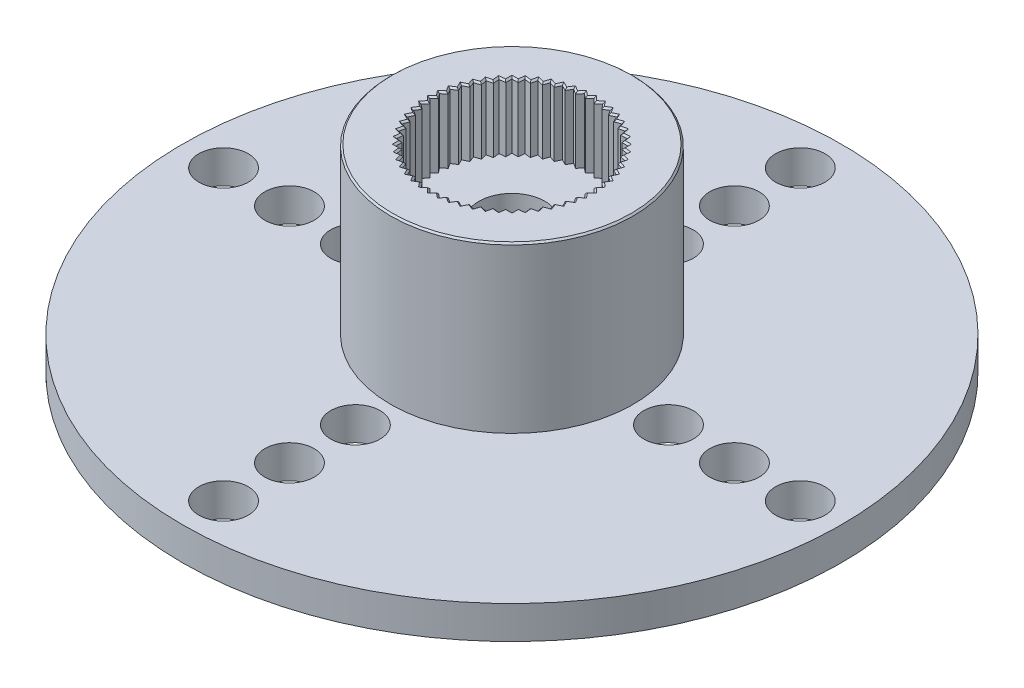
from build123d import *
from build123d.topology import SkipClean

# Parameters (mm, degrees)
SKETCH_1_R               = 0.75
SKETCH_1_R_2             = 1
EXTRUDE_1_DEPTH          = 1
SKETCH_2_R               = 3.67931812
EXTRUDE_2_DEPTH          = 5
SKETCH_1_4_R             = 1
CUT_EXTRUDE_2_DEPTH      = 13.228547822
SKETCH_3_R               = 2.355
CUT_EXTRUDE_3_DEPTH      = 2
CUT_EXTRUDE_4_REACH      = 13.381
PATTERN_CIRCULAR_1_COUNT = 56
CHAMFER_1_SIZE           = 0.05
SKETCH_6_R               = 0.75
EXTRUDE_3_DEPTH          = 1


with BuildPart() as part:
    # 草图1 → 凸台-拉伸1 (new body)
    with BuildSketch(Plane(origin=(0, 0, 0), x_dir=(1, 0, 0), z_dir=(0, 1, 0))):
        with BuildLine():
            Line((-2.945872845, 9.556245768), (-3.608885156, 1.677008569))
            ThreePointArc((-3.608885156, 1.677008569), (-3.67931812, 0), (-3.608885156, -1.677008569))
            Line((-3.608885156, -1.677008569), (-2.945872845, -9.556245768))
            ThreePointArc((-2.945872845, -9.556245768), (-1.489554001, -9.888439153), (2.6e-08, -10))
            ThreePointArc((2.6e-08, -10), (1.489554027, -9.888439149), (2.945872845, -9.556245768))
            Line((2.945872845, -9.556245768), (3.608885156, -1.677008569))
            ThreePointArc((3.608885156, -1.677008569), (3.67931812, 0), (3.608885156, 1.677008569))
            Line((3.608885156, 1.677008569), (2.945872845, 9.556245768))
            ThreePointArc((2.945872845, 9.556245768), (1.48955401, 9.888439151), (-7e-09, 10))
            ThreePointArc((-7e-09, 10), (-1.489554017, 9.88843915), (-2.945872845, 9.556245768))
        make_face()
        with Locations((0, -8.75)):
            Circle(SKETCH_1_R, mode=Mode.SUBTRACT)
        with Locations((0, -6.75)):
            Circle(SKETCH_1_R, mode=Mode.SUBTRACT)
        with Locations((0, -4.75)):
            Circle(SKETCH_1_R, mode=Mode.SUBTRACT)
        Circle(SKETCH_1_R_2, mode=Mode.SUBTRACT)
        with Locations((0, 4.75)):
            Circle(SKETCH_1_R, mode=Mode.SUBTRACT)
        with Locations((0, 6.75)):
            Circle(SKETCH_1_R, mode=Mode.SUBTRACT)
        with Locations((0, 8.75)):
            Circle(SKETCH_1_R, mode=Mode.SUBTRACT)
    extrude(amount=EXTRUDE_1_DEPTH)

    # 草图2 → 凸台-拉伸2 (add)
    with BuildSketch(Plane(origin=(0, 1, 0), x_dir=(1, 0, 0), z_dir=(0, 1, 0))):
        Circle(SKETCH_2_R)
    extrude(amount=EXTRUDE_2_DEPTH)

    # 草图1<4> → 切除-拉伸2 (cut, through all)
    with BuildSketch(Plane(origin=(0, 0, 0), x_dir=(1, 0, 0), z_dir=(0, 1, 0))):
        Circle(SKETCH_1_4_R)
    extrude(amount=CUT_EXTRUDE_2_DEPTH, mode=Mode.SUBTRACT)

    # 草图3 → 切除-拉伸3 (cut)
    with BuildSketch(Plane(origin=(0, 6, 0), x_dir=(1, 0, 0), z_dir=(0, 1, 0))):
        Circle(SKETCH_3_R)
    extrude(amount=-CUT_EXTRUDE_3_DEPTH, mode=Mode.SUBTRACT)

    # 草图5 → 切除-拉伸4 (cut, up to next)
    with BuildSketch(Plane(origin=(0, 4, 0), x_dir=(1, 0, 0), z_dir=(0, 1, 0)), mode=Mode.PRIVATE) as cut_extrude_4_sk1:
        with BuildLine():
            Line((0, 2.492171237), (0.141421356, 2.35074988))
            ThreePointArc((0.141421356, 2.35074988), (0, 2.355), (-0.141421356, 2.35074988))
            Line((-0.141421356, 2.35074988), (0, 2.492171237))
        make_face()
    cut_extrude_4_tool1 = extrude(cut_extrude_4_sk1.sketch, amount=CUT_EXTRUDE_4_REACH, mode=Mode.PRIVATE) & part.part
    cut_extrude_4 = cut_extrude_4_tool1.solids().sort_by_distance((0, 4, -2.399788))[0]
    add(cut_extrude_4, mode=Mode.SUBTRACT)

    # 阵列(圆周)1: 切除-拉伸4 ×56 about axis
    pattern_circular_1_axis = Axis((0, 4, 0), (0, 1, 0))
    for i in range(1, PATTERN_CIRCULAR_1_COUNT):
        add(cut_extrude_4.rotate(pattern_circular_1_axis, i * 360 / PATTERN_CIRCULAR_1_COUNT), mode=Mode.SUBTRACT)

    # 倒角1
    chamfer_1_edges = [part.edges().sort_by_distance(p)[0] for p in [
        (-0.475220048, 6, -2.379834534),
        (-0.604413037, 6, -2.350347077),
        (-0.738688891, 6, -2.31166287),
        (-0.863767994, 6, -2.267895799),
        (-0.992868293, 6, -2.214420705),
        (-1.112260567, 6, -2.156924416),
        (-1.234561799, 6, -2.089330914),
        (-1.346765819, 6, -2.018828456),
        (-1.460729975, 6, -1.937966575),
        (-1.564334708, 6, -1.855344557),
        (-1.668528624, 6, -1.762231181),
        (-1.762231181, 6, -1.668528624),
        (-1.855344557, 6, -1.564334708),
        (-1.937966575, 6, -1.460729975),
        (-2.018828456, 6, -1.346765819),
        (-2.089330914, 6, -1.234561799),
        (-2.156924416, 6, -1.112260567),
        (-2.214420705, 6, -0.992868293),
        (-2.267895799, 6, -0.863767994),
        (-2.31166287, 6, -0.738688891),
        (-2.350347077, 6, -0.604413037),
        (-2.379834534, 6, -0.475220048),
        (-2.403241377, 6, -0.337457236),
        (-2.418078398, 6, -0.205775037),
        (-2.425913523, 6, -0.066257714),
        (-2.425913523, 6, 0.066257714),
        (-2.418078398, 6, 0.205775037),
        (-2.403241377, 6, 0.337457236),
        (-2.379834534, 6, 0.475220048),
        (-2.350347077, 6, 0.604413037),
        (-2.31166287, 6, 0.738688891),
        (-2.267895799, 6, 0.863767994),
        (-2.214420705, 6, 0.992868293),
        (-2.156924416, 6, 1.112260567),
        (-2.089330914, 6, 1.234561799),
        (-2.018828456, 6, 1.346765819),
        (-1.937966575, 6, 1.460729975),
        (-1.855344557, 6, 1.564334708),
        (-1.762231181, 6, 1.668528624),
        (-1.668528624, 6, 1.762231181),
        (-1.564334708, 6, 1.855344557),
        (-1.460729975, 6, 1.937966575),
        (-1.346765819, 6, 2.018828456),
        (-1.234561799, 6, 2.089330914),
        (-1.112260567, 6, 2.156924416),
        (-0.992868293, 6, 2.214420705),
        (-0.863767994, 6, 2.267895799),
        (-0.738688891, 6, 2.31166287),
        (-0.604413037, 6, 2.350347077),
        (-0.475220048, 6, 2.379834534),
        (-0.337457236, 6, 2.403241377),
        (-0.205775037, 6, 2.418078398),
        (-0.066257714, 6, 2.425913523),
        (0.066257714, 6, 2.425913523),
        (0.205775037, 6, 2.418078398),
        (0.337457236, 6, 2.403241377),
        (0.475220048, 6, 2.379834534),
        (0.604413037, 6, 2.350347077),
        (0.738688891, 6, 2.31166287),
        (0.863767994, 6, 2.267895799),
        (0.992868293, 6, 2.214420705),
        (1.112260567, 6, 2.156924416),
        (1.234561799, 6, 2.089330914),
        (1.346765819, 6, 2.018828456),
        (1.460729975, 6, 1.937966575),
        (1.564334708, 6, 1.855344557),
        (1.668528624, 6, 1.762231181),
        (1.762231181, 6, 1.668528624),
        (1.855344557, 6, 1.564334708),
        (1.937966575, 6, 1.460729975),
        (2.018828456, 6, 1.346765819),
        (2.089330914, 6, 1.234561799),
        (2.156924416, 6, 1.112260567),
        (2.214420705, 6, 0.992868293),
        (2.267895799, 6, 0.863767994),
        (2.31166287, 6, 0.738688891),
        (2.350347077, 6, 0.604413037),
        (2.379834534, 6, 0.475220048),
        (2.403241377, 6, 0.337457236),
        (2.418078398, 6, 0.205775037),
        (2.425913523, 6, 0.066257714),
        (2.425913523, 6, -0.066257714),
        (2.418078398, 6, -0.205775037),
        (2.403241377, 6, -0.337457236),
        (2.379834534, 6, -0.475220048),
        (2.350347077, 6, -0.604413037),
        (2.31166287, 6, -0.738688891),
        (2.267895799, 6, -0.863767994),
        (2.214420705, 6, -0.992868293),
        (2.156924416, 6, -1.112260567),
        (2.089330914, 6, -1.234561799),
        (2.018828456, 6, -1.346765819),
        (1.937966575, 6, -1.460729975),
        (1.855344557, 6, -1.564334708),
        (1.762231181, 6, -1.668528624),
        (1.668528624, 6, -1.762231181),
        (1.564334708, 6, -1.855344557),
        (1.460729975, 6, -1.937966575),
        (1.346765819, 6, -2.018828456),
        (1.234561799, 6, -2.089330914),
        (1.112260567, 6, -2.156924416),
        (0.992868293, 6, -2.214420705),
        (0.863767994, 6, -2.267895799),
        (0.738688891, 6, -2.31166287),
        (0.604413037, 6, -2.350347077),
        (0.475220048, 6, -2.379834534),
        (0.337457236, 6, -2.403241377),
        (0.205775037, 6, -2.418078398),
        (0.066257714, 6, -2.425913523),
        (-0.066257714, 6, -2.425913523),
        (-0.205775037, 6, -2.418078398),
        (-0.337457236, 6, -2.403241377),
        (-3.67931812, 6, 0),
    ]]
    chamfer(chamfer_1_edges, length=CHAMFER_1_SIZE)

    # 草图6 → 凸台-拉伸3 (add)
    # profile 1 of 2: a face of its own
    with SkipClean():  # the faces are left unmerged after this step: merging them gives an invalid solid
        with BuildSketch(Plane.XZ):
            with BuildLine():
                ThreePointArc((3.608885156, 1.677008569), (3.67931812, 0), (3.608885156, -1.677008569))
                Line((3.608885156, -1.677008569), (2.945872845, -9.556245768))
                ThreePointArc((2.945872845, -9.556245768), (10, 0), (2.945872845, 9.556245768))
                Line((2.945872845, 9.556245768), (3.608885156, 1.677008569))
            make_face()
            with Locations((4.75, 0)):
                Circle(SKETCH_6_R, mode=Mode.SUBTRACT)
            with Locations((6.75, 0)):
                Circle(SKETCH_6_R, mode=Mode.SUBTRACT)
            with Locations((8.75, 0)):
                Circle(SKETCH_6_R, mode=Mode.SUBTRACT)
        # profile 2 of 2: a face of its own
        with BuildSketch(Plane.XZ):
            with BuildLine():
                ThreePointArc((-2.945872845, 9.556245768), (-10, 0), (-2.945872845, -9.556245768))
                Line((-2.945872845, -9.556245768), (-3.608885156, -1.677008569))
                ThreePointArc((-3.608885156, -1.677008569), (-3.67931812, 0), (-3.608885156, 1.677008569))
                Line((-3.608885156, 1.677008569), (-2.945872845, 9.556245768))
            make_face()
            with Locations((-8.75, 0)):
                Circle(SKETCH_6_R, mode=Mode.SUBTRACT)
            with Locations((-6.75, 0)):
                Circle(SKETCH_6_R, mode=Mode.SUBTRACT)
            with Locations((-4.75, 0)):
                Circle(SKETCH_6_R, mode=Mode.SUBTRACT)
        extrude(amount=-EXTRUDE_3_DEPTH)


solid = part.part
